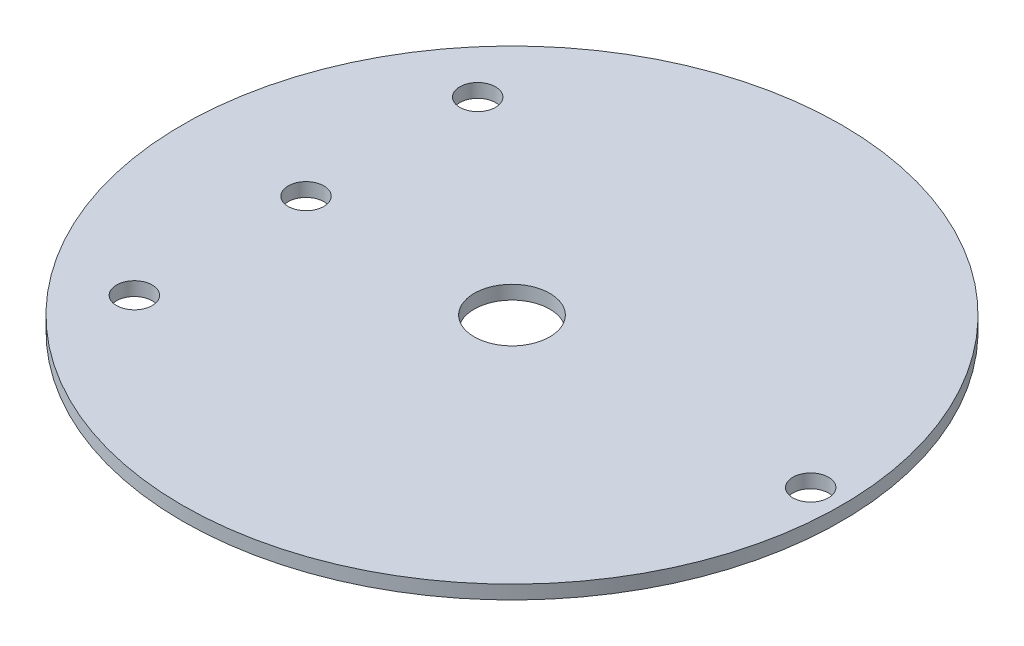
from build123d import *

# Parameters (mm, degrees)
SKETCH1_R           = 48
SKETCH1_R_2         = 2.6
SKETCH1_R_3         = 5.5
BOSS_EXTRUDE1_DEPTH = 2


with BuildPart() as part:
    # Sketch1 → Boss-Extrude1 (new body)
    with BuildSketch(Plane(origin=(0, 0, 0), x_dir=(1, 0, 0), z_dir=(0, 1, 0))):
        Circle(SKETCH1_R)
        with Locations((-30, 0)):
            Circle(SKETCH1_R_2, mode=Mode.SUBTRACT)
        Circle(SKETCH1_R_3, mode=Mode.SUBTRACT)
        with Locations((-30, 25)):
            Circle(SKETCH1_R_2, mode=Mode.SUBTRACT)
        with Locations((-30, -25)):
            Circle(SKETCH1_R_2, mode=Mode.SUBTRACT)
        with Locations((43.5, 0)):
            Circle(SKETCH1_R_2, mode=Mode.SUBTRACT)
    extrude(amount=BOSS_EXTRUDE1_DEPTH)


solid = part.part
